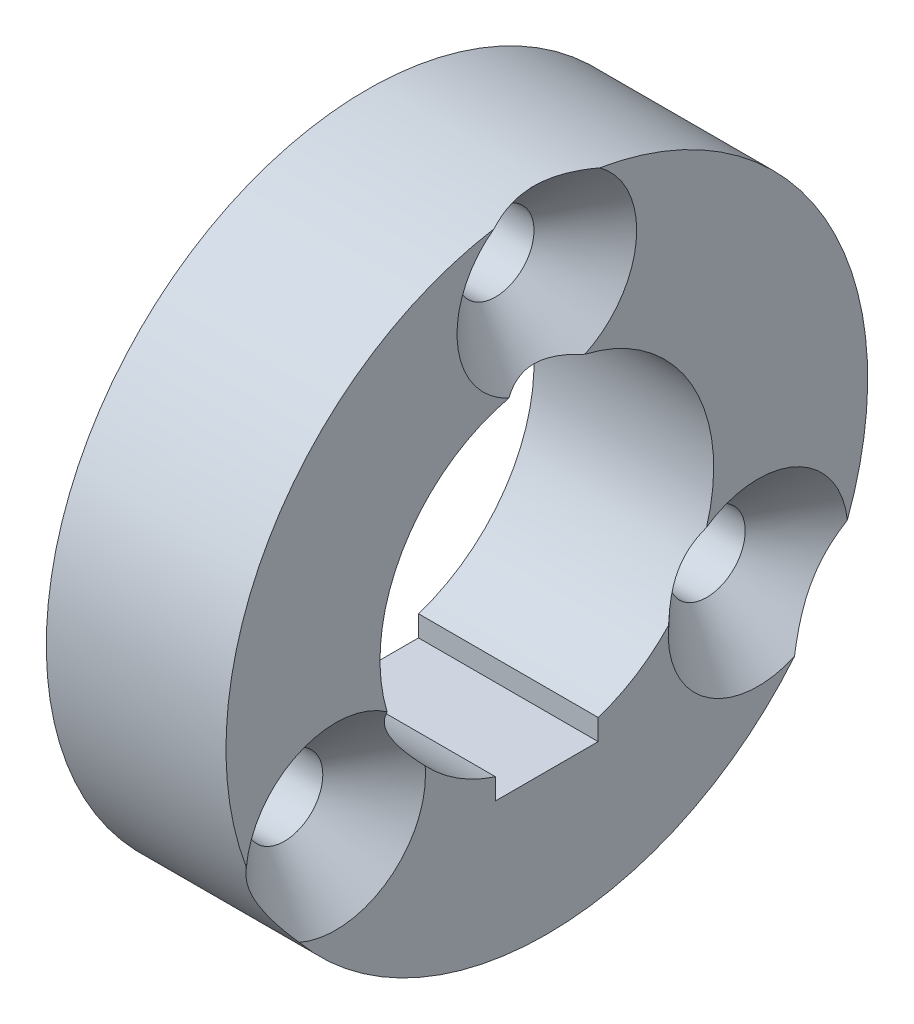
from build123d import *

# Parameters (mm, degrees)
SKETCH1_R           = 12.5
SKETCH1_R_2         = 6.5
SKETCH1_R_3         = 1.5
BOSS_EXTRUDE1_DEPTH = 7
CHAMFER1_SIZE       = 2
SKETCH2_W           = 4
SKETCH2_H           = 4
CUT_EXTRUDE1_DEPTH  = 10


with BuildPart() as part:
    # Sketch1 → Boss-Extrude1 (new body)
    with BuildSketch(Plane(origin=(0, 0, 0), x_dir=(0, 0, -1), z_dir=(1, 0, 0))):
        Circle(SKETCH1_R)
        Circle(SKETCH1_R_2, mode=Mode.SUBTRACT)
        with Locations((0, 9.5)):
            Circle(SKETCH1_R_3, mode=Mode.SUBTRACT)
        with Locations((-8.227241336, -4.75)):
            Circle(SKETCH1_R_3, mode=Mode.SUBTRACT)
        with Locations((8.227241336, -4.75)):
            Circle(SKETCH1_R_3, mode=Mode.SUBTRACT)
    extrude(amount=BOSS_EXTRUDE1_DEPTH)

    # Chamfer1
    # the kernel refuses this chamfer: 2 mm, written as the material it takes off along each edge
    with BuildSketch(Plane(origin=(7, -4.75, 8.227241336), x_dir=(0, 0, -1), z_dir=(0, -1, 0))) as chamfer1_piece_1:
        Polygon((1.5, -CHAMFER1_SIZE), (1.5 + CHAMFER1_SIZE, 0), (1.5, 0), align=None)
    revolve(axis=Axis((7, -4.75, 8.227241336), (1, 0, 0)), mode=Mode.SUBTRACT)
    with BuildSketch(Plane(origin=(7, -4.75, -8.227241336), x_dir=(0, 0, -1), z_dir=(0, -1, 0))) as chamfer1_piece_2:
        Polygon((1.5, -CHAMFER1_SIZE), (1.5 + CHAMFER1_SIZE, 0), (1.5, 0), align=None)
    revolve(axis=Axis((7, -4.75, -8.227241336), (1, 0, 0)), mode=Mode.SUBTRACT)
    with BuildSketch(Plane(origin=(7, 9.5, 0), x_dir=(0, 0, -1), z_dir=(0, -1, 0))) as chamfer1_piece_3:
        Polygon((1.5, -CHAMFER1_SIZE), (1.5 + CHAMFER1_SIZE, 0), (1.5, 0), align=None)
    revolve(axis=Axis((7, 9.5, 0), (1, 0, 0)), mode=Mode.SUBTRACT)

    # Sketch2 → Cut-Extrude1 (cut)
    with BuildSketch(Plane.ZY):
        with Locations((0, -5)):
            Rectangle(SKETCH2_W, SKETCH2_H)
    extrude(amount=-CUT_EXTRUDE1_DEPTH, mode=Mode.SUBTRACT)


solid = part.part
